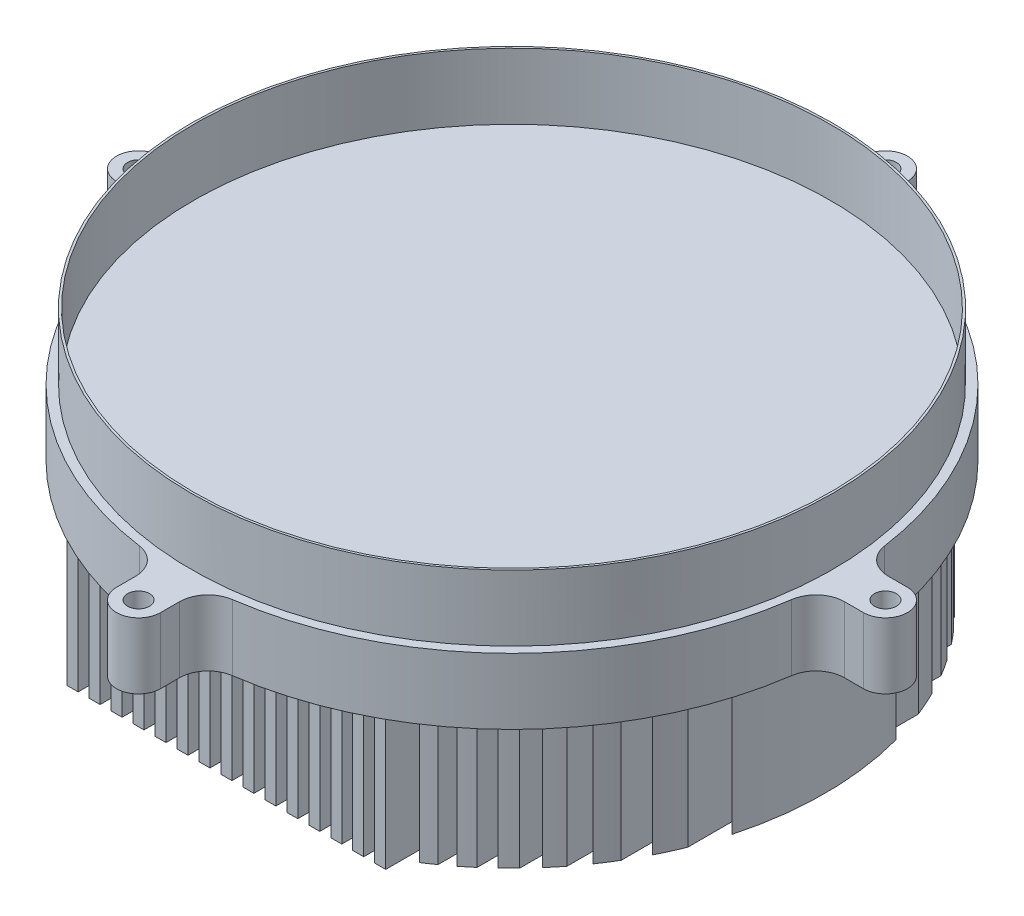
from build123d import *

# Parameters (mm, degrees)
SKETCH2_R           = 146
SKETCH2_R_2         = 145
BOSS_EXTRUDE2_DEPTH = 30
SKETCH3_R           = 5
BOSS_EXTRUDE4_DEPTH = 30
SKETCH4_W           = 5
SKETCH4_H           = 260
BOSS_EXTRUDE5_DEPTH = 60


with BuildPart() as part:
    # Sketch2 → Boss-Extrude2 (new body)
    with BuildSketch(Plane(origin=(0, 0, 0), x_dir=(1, 0, 0), z_dir=(0, 1, 0))):
        Circle(SKETCH2_R)
        Circle(SKETCH2_R_2, mode=Mode.SUBTRACT)
    extrude(amount=BOSS_EXTRUDE2_DEPTH)

    # Sketch3 → Boss-Extrude4 (add)
    with BuildSketch(Plane(origin=(0, 0, 0), x_dir=(1, 0, 0), z_dir=(0, 1, 0))):
        with BuildLine():
            Line((161.369142032, 10), (170, 10))
            ThreePointArc((170, 10), (180, 0), (170, -10))
            Line((170, -10), (161.369142032, -10))
            ThreePointArc((161.369142032, -10), (152.849946816, -13.180462695), (148.499210458, -21.165644172))
            ThreePointArc((148.499210458, -21.165644172), (106.066017178, -106.066017178), (21.165644172, -148.499210458))
            ThreePointArc((21.165644172, -148.499210458), (13.180462695, -152.849946816), (10, -161.369142032))
            Line((10, -161.369142032), (10, -170))
            ThreePointArc((10, -170), (0, -180), (-10, -170))
            Line((-10, -170), (-10, -161.369142032))
            ThreePointArc((-10, -161.369142032), (-13.180462695, -152.849946816), (-21.165644172, -148.499210458))
            ThreePointArc((-21.165644172, -148.499210458), (-106.066017178, -106.066017178), (-148.499210458, -21.165644172))
            ThreePointArc((-148.499210458, -21.165644172), (-152.849946816, -13.180462695), (-161.369142032, -10))
            Line((-161.369142032, -10), (-170, -10))
            ThreePointArc((-170, -10), (-180, 0), (-170, 10))
            Line((-170, 10), (-161.369142032, 10))
            ThreePointArc((-161.369142032, 10), (-152.849946816, 13.180462695), (-148.499210458, 21.165644172))
            ThreePointArc((-148.499210458, 21.165644172), (-106.066017178, 106.066017178), (-21.165644172, 148.499210458))
            ThreePointArc((-21.165644172, 148.499210458), (-13.180462695, 152.849946816), (-10, 161.369142032))
            Line((-10, 161.369142032), (-10, 170))
            ThreePointArc((-10, 170), (0, 180), (10, 170))
            Line((10, 170), (10, 161.369142032))
            ThreePointArc((10, 161.369142032), (13.180462695, 152.849946816), (21.165644172, 148.499210458))
            ThreePointArc((21.165644172, 148.499210458), (106.066017178, 106.066017178), (148.499210458, 21.165644172))
            ThreePointArc((148.499210458, 21.165644172), (152.849946816, 13.180462695), (161.369142032, 10))
        make_face()
        with Locations((0, 170)):
            Circle(SKETCH3_R, mode=Mode.SUBTRACT)
        with Locations((170, 0)):
            Circle(SKETCH3_R, mode=Mode.SUBTRACT)
        with Locations((0, -170)):
            Circle(SKETCH3_R, mode=Mode.SUBTRACT)
        with Locations((-170, 0)):
            Circle(SKETCH3_R, mode=Mode.SUBTRACT)
    extrude(amount=-BOSS_EXTRUDE4_DEPTH)

    # Sketch4 → Boss-Extrude5 (add)
    with BuildSketch(Plane(origin=(0, -30, 0), x_dir=(1, 0, 0), z_dir=(0, 1, 0))):
        Rectangle(SKETCH4_W, SKETCH4_H)
        with Locations((10, 0)):
            Rectangle(SKETCH4_W, SKETCH4_H)
        with Locations((20, 0)):
            Rectangle(SKETCH4_W, SKETCH4_H)
        with Locations((30, 0)):
            Rectangle(SKETCH4_W, SKETCH4_H)
        with Locations((40, 0)):
            Rectangle(SKETCH4_W, SKETCH4_H)
        with Locations((50, 0)):
            Rectangle(SKETCH4_W, SKETCH4_H)
        with Locations((60, 0)):
            Rectangle(SKETCH4_W, SKETCH4_H)
        with Locations((70, 0)):
            Rectangle(SKETCH4_W, SKETCH4_H)
        with BuildLine():
            Line((82.5, 116.189500386), (82.5, -116.189500386))
            ThreePointArc((82.5, -116.189500386), (80.017987314, -117.912559578), (77.5, -119.582607431))
            Line((77.5, -119.582607431), (77.5, 119.582607431))
            ThreePointArc((77.5, 119.582607431), (80.017987314, 117.912559578), (82.5, 116.189500386))
        make_face()
        with BuildLine():
            Line((92.5, 108.397416943), (92.5, -108.397416943))
            ThreePointArc((92.5, -108.397416943), (90.023058171, -110.463111478), (87.5, -112.472218792))
            Line((87.5, -112.472218792), (87.5, 112.472218792))
            ThreePointArc((87.5, 112.472218792), (90.023058171, 110.463111478), (92.5, 108.397416943))
        make_face()
        with BuildLine():
            Line((102.5, 98.994949366), (102.5, -98.994949366))
            ThreePointArc((102.5, -98.994949366), (100.030353094, -101.489794856), (97.5, -103.923048454))
            Line((97.5, -103.923048454), (97.5, 103.923048454))
            ThreePointArc((97.5, 103.923048454), (100.030353094, 101.489794856), (102.5, 98.994949366))
        make_face()
        with BuildLine():
            Line((112.5, 87.464278423), (112.5, -87.464278423))
            ThreePointArc((112.5, -87.464278423), (110.041959984, -90.537379258), (107.5, -93.541434669))
            Line((107.5, -93.541434669), (107.5, 93.541434669))
            ThreePointArc((107.5, 93.541434669), (110.041959984, 90.537379258), (112.5, 87.464278423))
        make_face()
        with Locations((-10, 0)):
            Rectangle(SKETCH4_W, SKETCH4_H)
        with Locations((-20, 0)):
            Rectangle(SKETCH4_W, SKETCH4_H)
        with Locations((-30, 0)):
            Rectangle(SKETCH4_W, SKETCH4_H)
        with Locations((-40, 0)):
            Rectangle(SKETCH4_W, SKETCH4_H)
        with Locations((-50, 0)):
            Rectangle(SKETCH4_W, SKETCH4_H)
        with Locations((-60, 0)):
            Rectangle(SKETCH4_W, SKETCH4_H)
        with Locations((-70, 0)):
            Rectangle(SKETCH4_W, SKETCH4_H)
        with BuildLine():
            Line((-82.5, 116.189500386), (-82.5, -116.189500386))
            ThreePointArc((-82.5, -116.189500386), (-80.017987314, -117.912559578), (-77.5, -119.582607431))
            Line((-77.5, -119.582607431), (-77.5, 119.582607431))
            ThreePointArc((-77.5, 119.582607431), (-80.017987314, 117.912559578), (-82.5, 116.189500386))
        make_face()
        with BuildLine():
            Line((-92.5, 108.397416943), (-92.5, -108.397416943))
            ThreePointArc((-92.5, -108.397416943), (-90.023058171, -110.463111478), (-87.5, -112.472218792))
            Line((-87.5, -112.472218792), (-87.5, 112.472218792))
            ThreePointArc((-87.5, 112.472218792), (-90.023058171, 110.463111478), (-92.5, 108.397416943))
        make_face()
        with BuildLine():
            Line((-102.5, 98.994949366), (-102.5, -98.994949366))
            ThreePointArc((-102.5, -98.994949366), (-100.030353094, -101.489794856), (-97.5, -103.923048454))
            Line((-97.5, -103.923048454), (-97.5, 103.923048454))
            ThreePointArc((-97.5, 103.923048454), (-100.030353094, 101.489794856), (-102.5, 98.994949366))
        make_face()
        with BuildLine():
            Line((-112.5, 87.464278423), (-112.5, -87.464278423))
            ThreePointArc((-112.5, -87.464278423), (-110.041959984, -90.537379258), (-107.5, -93.541434669))
            Line((-107.5, -93.541434669), (-107.5, 93.541434669))
            ThreePointArc((-107.5, 93.541434669), (-110.041959984, 90.537379258), (-112.5, 87.464278423))
        make_face()
        with BuildLine():
            Line((-122.5, 72.801098893), (-122.5, -72.801098893))
            ThreePointArc((-122.5, -72.801098893), (-120.063707597, -76.752564245), (-117.5, -80.622577483))
            Line((-117.5, -80.622577483), (-117.5, 80.622577483))
            ThreePointArc((-117.5, 80.622577483), (-120.063707597, 76.752564245), (-122.5, 72.801098893))
        make_face()
        with BuildLine():
            Line((-132.5, 52.440442409), (-132.5, -52.440442409))
            ThreePointArc((-132.5, -52.440442409), (-130.120541577, -58.09384356), (-127.5, -63.639610307))
            Line((-127.5, -63.639610307), (-127.5, 63.639610307))
            ThreePointArc((-127.5, 63.639610307), (-130.120541577, 58.09384356), (-132.5, 52.440442409))
        make_face()
        with BuildLine():
            Line((-137.5, 37.416573868), (-137.5, -37.416573868))
            ThreePointArc((-137.5, -37.416573868), (-142.5, 0), (-137.5, 37.416573868))
        make_face()
        with BuildLine():
            Line((122.5, 72.801098893), (122.5, -72.801098893))
            ThreePointArc((122.5, -72.801098893), (120.063707597, -76.752564245), (117.5, -80.622577483))
            Line((117.5, -80.622577483), (117.5, 80.622577483))
            ThreePointArc((117.5, 80.622577483), (120.063707597, 76.752564245), (122.5, 72.801098893))
        make_face()
        with BuildLine():
            Line((132.5, 52.440442409), (132.5, -52.440442409))
            ThreePointArc((132.5, -52.440442409), (130.120541577, -58.09384356), (127.5, -63.639610307))
            Line((127.5, -63.639610307), (127.5, 63.639610307))
            ThreePointArc((127.5, 63.639610307), (130.120541577, 58.09384356), (132.5, 52.440442409))
        make_face()
        with BuildLine():
            Line((137.5, 37.416573868), (137.5, -37.416573868))
            ThreePointArc((137.5, -37.416573868), (142.5, 0), (137.5, 37.416573868))
        make_face()
    extrude(amount=-BOSS_EXTRUDE5_DEPTH)


solid = part.part
